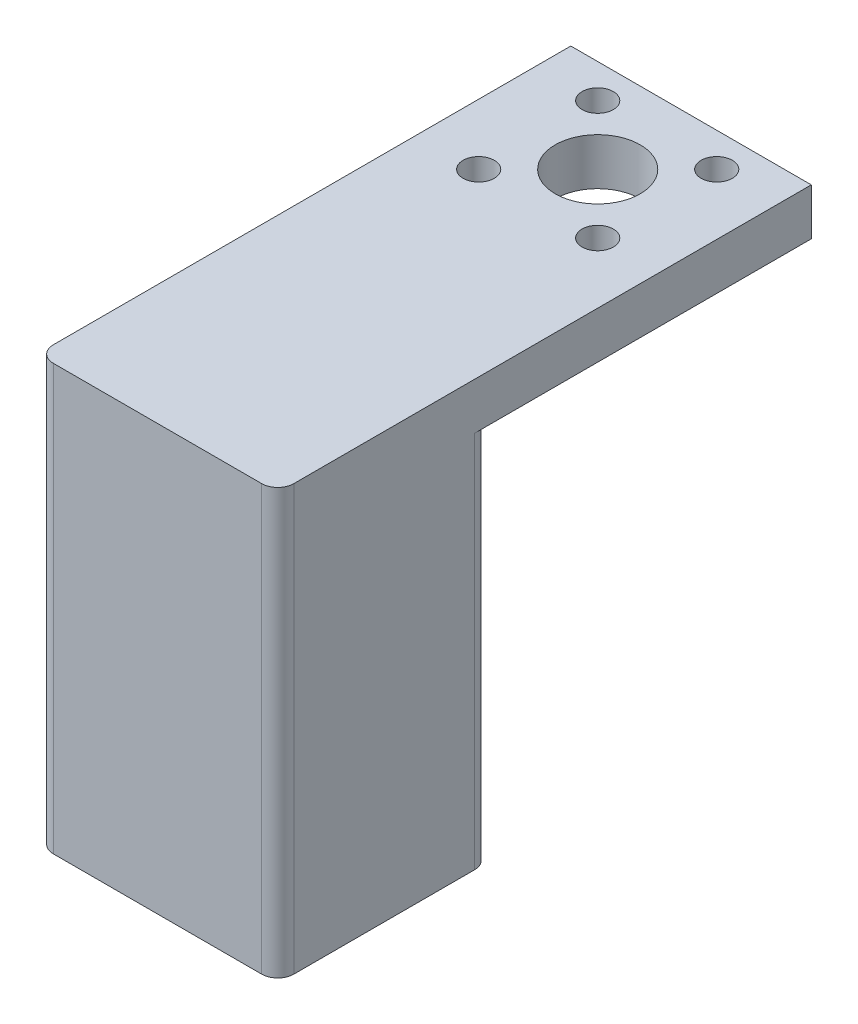
from build123d import *

# Parameters (mm, degrees)
CROQUIS1_W              = 30
CROQUIS1_H              = 26.5572604
CROQUIS1_W_2            = 24
CROQUIS1_H_2            = 21.24580832
SALIENTE_EXTRUIR1_DEPTH = 50
CROQUIS2_W              = 30
CROQUIS2_H              = 26.5572604
SALIENTE_EXTRUIR2_DEPTH = 3
CROQUIS6_W              = 30
CROQUIS6_H              = 5.83764523
SALIENTE_EXTRUIR4_DEPTH = 40
CROQUIS7_R              = 5.3
CROQUIS7_R_2            = 1.95
CORTAR_EXTRUIR2_DEPTH   = 40
REDONDEO1_R             = 2


with BuildPart() as part:
    # Croquis1 → Saliente-Extruir1 (new body)
    with BuildSketch(Plane(origin=(0, 0, 0), x_dir=(1, 0, 0), z_dir=(0, 1, 0))):
        Rectangle(CROQUIS1_W, CROQUIS1_H)
        Rectangle(CROQUIS1_W_2, CROQUIS1_H_2, mode=Mode.SUBTRACT)
    extrude(amount=SALIENTE_EXTRUIR1_DEPTH)

    # Croquis2 → Saliente-Extruir2 (add)
    with BuildSketch(Plane(origin=(0, 50, 0), x_dir=(1, 0, 0), z_dir=(0, 1, 0))):
        Rectangle(CROQUIS2_W, CROQUIS2_H)
    extrude(amount=SALIENTE_EXTRUIR2_DEPTH)

    # Croquis6 → Saliente-Extruir4 (add)
    with BuildSketch(Plane(origin=(0, 0, -13.2786302), x_dir=(-1, 0, 0), z_dir=(0, 0, -1))):
        with Locations((0, 50.081177385)):
            Rectangle(CROQUIS6_W, CROQUIS6_H)
    extrude(amount=SALIENTE_EXTRUIR4_DEPTH)

    # Croquis7 → Cortar-Extruir2 (cut)
    with BuildSketch(Plane(origin=(0, 53, 0), x_dir=(1, 0, 0), z_dir=(0, 1, 0))):
        with Locations((0, 41.634609849)):
            Circle(CROQUIS7_R)
        with Locations((7.424621202, 49.059231051)):
            Circle(CROQUIS7_R_2)
        with Locations((7.424621202, 34.209988647)):
            Circle(CROQUIS7_R_2)
        with Locations((-7.424621202, 34.209988647)):
            Circle(CROQUIS7_R_2)
        with Locations((-7.424621202, 49.059231051)):
            Circle(CROQUIS7_R_2)
    extrude(amount=-CORTAR_EXTRUIR2_DEPTH, mode=Mode.SUBTRACT)

    # Redondeo1
    redondeo1_edges = [part.edges().sort_by_distance(p)[0] for p in [
        (-15, 26.5, 13.2786302),
        (15, 26.5, 13.2786302),
        (15, 23.581177385, -13.2786302),
        (-15, 23.581177385, -13.2786302),
        (-12, 25, 10.62290416),
        (-12, 25, -10.62290416),
        (12, 25, 10.62290416),
        (12, 25, -10.62290416),
    ]]
    fillet(redondeo1_edges, radius=REDONDEO1_R)


solid = part.part
